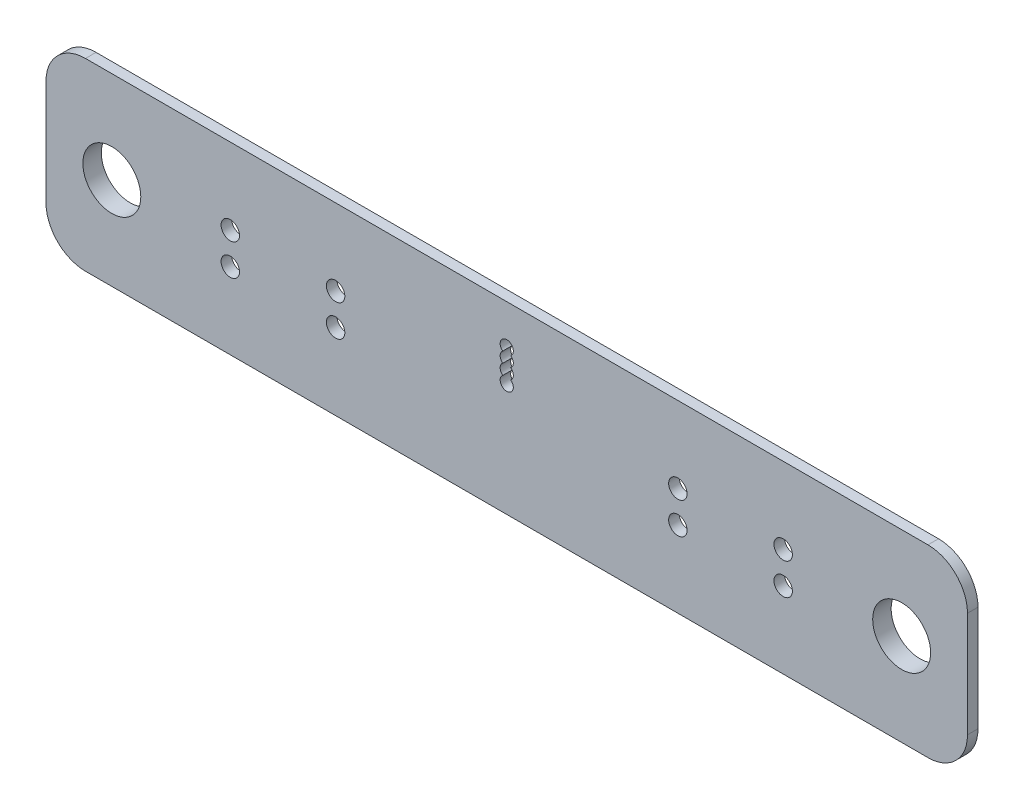
from build123d import *
from build123d.topology import SkipClean

# Parameters (mm, degrees)
SKETCH1_W           = 350
SKETCH1_H           = 70
BOSS_EXTRUDE1_DEPTH = 4
FILLET1_R           = 15
SKETCH2_R           = 11
CUT_EXTRUDE1_DEPTH  = 10
BOSS_EXTRUDE2_START = 9
SKETCH3_R           = 13.5
SKETCH3_R_2         = 11
BOSS_EXTRUDE2_DEPTH = 9
SKETCH4_R           = 3.5
CUT_EXTRUDE3_DEPTH  = 10
SKETCH6_W           = 350
SKETCH6_H           = 10.524429933
CUT_EXTRUDE5_DEPTH  = 116
BOSS_EXTRUDE3_START = 3
SKETCH7_R           = 13.5
SKETCH7_R_2         = 11
BOSS_EXTRUDE3_DEPTH = 3


with BuildPart() as part:
    # Sketch1 → Boss-Extrude1 (new body)
    with BuildSketch(Plane.XY):
        Rectangle(SKETCH1_W, SKETCH1_H)
    extrude(amount=BOSS_EXTRUDE1_DEPTH)

    # Fillet1
    fillet1_edges = [part.edges().sort_by_distance(p)[0] for p in [
        (175, -35, 2),
        (175, 35, 2),
        (-175, -35, 2),
        (-175, 35, 2),
    ]]
    fillet(fillet1_edges, radius=FILLET1_R)

    # Sketch2 → Cut-Extrude1 (cut)
    with BuildSketch(Plane(origin=(0, 0, 0), x_dir=(-1, 0, 0), z_dir=(0, 0, -1))):
        with Locations((-150, 0)):
            Circle(SKETCH2_R)
    cut_extrude1 = extrude(amount=-CUT_EXTRUDE1_DEPTH, mode=Mode.SUBTRACT)

    # Sketch3 → Boss-Extrude2 (add)
    with BuildSketch(Plane(origin=(0, 0, 0), x_dir=(-1, 0, 0), z_dir=(0, 0, -1)).offset(BOSS_EXTRUDE2_START)):
        with Locations((-150, 0)):
            Circle(SKETCH3_R)
        with Locations((-150, 0)):
            Circle(SKETCH3_R_2, mode=Mode.SUBTRACT)
    boss_extrude2 = extrude(amount=-BOSS_EXTRUDE2_DEPTH)

    # Mirror2: Cut-Extrude1, Boss-Extrude2 across plane
    add(cut_extrude1.mirror(Plane(origin=(0, 0, 0), x_dir=(0, 0, 1), z_dir=(1, 0, 0))), mode=Mode.SUBTRACT)
    add(boss_extrude2.mirror(Plane(origin=(0, 0, 0), x_dir=(0, 0, 1), z_dir=(1, 0, 0))))

    # Sketch4 → Cut-Extrude3 (cut)
    with BuildSketch(Plane.XY.offset(4)):
        with Locations((-105, 6)):
            Circle(SKETCH4_R)
        with Locations((-105, -6)):
            Circle(SKETCH4_R)
        with Locations((-65, -6)):
            Circle(SKETCH4_R)
        with Locations((-65, 6)):
            Circle(SKETCH4_R)
        with Locations((65, 6)):
            Circle(SKETCH4_R)
        with Locations((65, -6)):
            Circle(SKETCH4_R)
        with Locations((105, -6)):
            Circle(SKETCH4_R)
        with Locations((105, 6)):
            Circle(SKETCH4_R)
        with BuildLine():
            ThreePointArc((1.5, 18), (0, 22.5), (-1.5, 18))
            ThreePointArc((-1.5, 18), (-2.5, 16), (-1.5, 14))
            ThreePointArc((-1.5, 14), (-2.5, 12), (-1.5, 10))
            ThreePointArc((-1.5, 10), (0, 5.5), (1.5, 10))
            ThreePointArc((1.5, 10), (2.5, 12), (1.5, 14))
            ThreePointArc((1.5, 14), (2.5, 16), (1.5, 18))
        make_face()
    extrude(amount=-CUT_EXTRUDE3_DEPTH, mode=Mode.SUBTRACT)

    # Sketch6 → Cut-Extrude5 (cut)
    with BuildSketch(Plane(origin=(0, 35, 0), x_dir=(1, 0, 0), z_dir=(0, 1, 0))):
        with Locations((0, 5.262214967)):
            Rectangle(SKETCH6_W, SKETCH6_H)
    extrude(amount=-CUT_EXTRUDE5_DEPTH, mode=Mode.SUBTRACT)

    # Sketch7 → Boss-Extrude3 (add)
    # profile 1 of 2: a face of its own
    with SkipClean():  # the faces are left unmerged after this step: merging them gives an invalid solid
        with BuildSketch(Plane(origin=(0, 0, 0), x_dir=(-1, 0, 0), z_dir=(0, 0, -1)).offset(BOSS_EXTRUDE3_START)):
            with Locations((-150, 0)):
                Circle(SKETCH7_R)
            with Locations((-150, 0)):
                Circle(SKETCH7_R_2, mode=Mode.SUBTRACT)
        # profile 2 of 2: a face of its own
        with BuildSketch(Plane(origin=(0, 0, 0), x_dir=(-1, 0, 0), z_dir=(0, 0, -1)).offset(BOSS_EXTRUDE3_START)):
            with Locations((150, 0)):
                Circle(SKETCH7_R)
            with Locations((150, 0)):
                Circle(SKETCH7_R_2, mode=Mode.SUBTRACT)
        extrude(amount=-BOSS_EXTRUDE3_DEPTH)
    add(part.part.scale(1), mode=Mode.REPLACE)  # the faces are merged on a copy


solid = part.part
